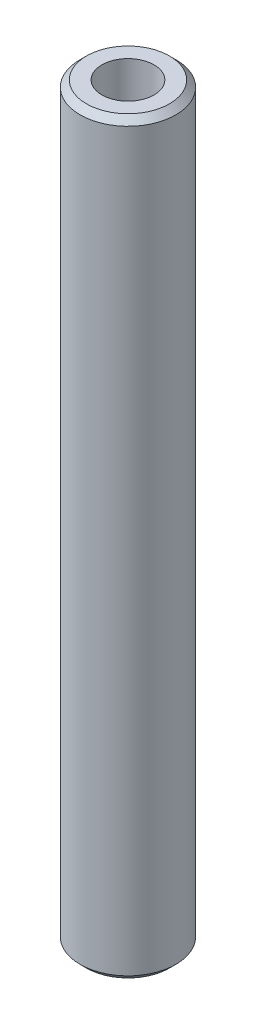
from build123d import *

# Parameters (mm, degrees)
SKETCH1_R           = 15
BOSS_EXTRUDE1_DEPTH = 234.536348478
SKETCH2_R           = 8.180673114
CUT_EXTRUDE1_DEPTH  = 236.493734009
CHAMFER1_SIZE       = 1.99442312


with BuildPart() as part:
    # Sketch1 → Boss-Extrude1 (new body)
    with BuildSketch(Plane(origin=(0, 0, 0), x_dir=(1, 0, 0), z_dir=(0, 1, 0))):
        Circle(SKETCH1_R)
    extrude(amount=BOSS_EXTRUDE1_DEPTH)

    # Sketch2 → Cut-Extrude1 (cut, through all)
    with BuildSketch(Plane(origin=(0, 0, 0), x_dir=(1, 0, 0), z_dir=(0, 1, 0))):
        Circle(SKETCH2_R)
    extrude(amount=CUT_EXTRUDE1_DEPTH, mode=Mode.SUBTRACT)

    # Chamfer1
    chamfer1_edges = [part.edges().sort_by_distance(p)[0] for p in [
        (-15, 234.536348478, 0),
        (-15, 0, 0),
    ]]
    chamfer(chamfer1_edges, length=CHAMFER1_SIZE)


solid = part.part
